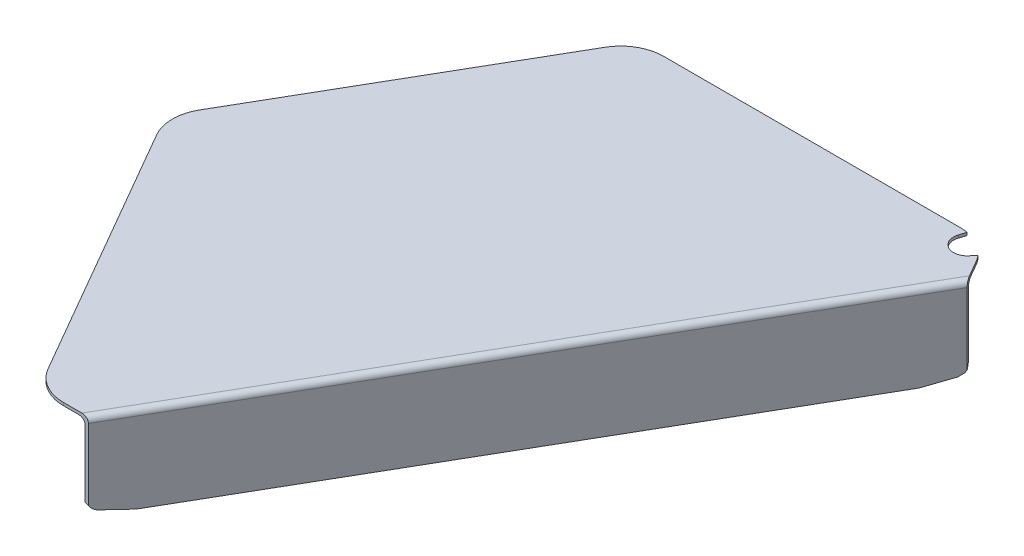
from build123d import *

# Parameters (mm, degrees)
SALIENTE_EXTRUIR1_DEPTH = 1
SALIENTE_EXTRUIR2_DEPTH = 31
REDONDEO1_R             = 2
CORTAR_EXTRUIR1_DEPTH   = 6


with BuildPart() as part:
    # Croquis1 → Saliente-Extruir1 (new body)
    with BuildSketch(Plane(origin=(0, 0, 0), x_dir=(1, 0, 0), z_dir=(0, 1, 0))):
        with BuildLine():
            Line((-115.079714212, -8.823380035), (-63.118189984, -98.823380035))
            ThreePointArc((-63.118189984, -98.823380035), (-57.627808928, -104.313761092), (-50.127808928, -106.323380035))
            Line((-50.127808928, -106.323380035), (-41.46755489, -106.323380035))
            Line((-41.46755489, -106.323380035), (71.115747602, 88.676619965))
            Line((71.115747602, 88.676619965), (66.785620583, 96.176619965))
            ThreePointArc((66.785620583, 96.176619965), (66.063002538, 97.308073533), (65.242113494, 98.370384784))
            Line((65.242113494, 98.370384784), (63.931741209, 96.784762544))
            ThreePointArc((63.931741209, 96.784762544), (57.937576979, 95.44880576), (55.609284572, 101.131572674))
            Line((55.609284572, 101.131572674), (56.358401529, 103.456004274))
            ThreePointArc((56.358401529, 103.456004274), (55.08155896, 103.621364269), (53.795239526, 103.676619965))
            Line((53.795239526, 103.676619965), (-50.127808928, 103.676619965))
            ThreePointArc((-50.127808928, 103.676619965), (-57.627808928, 101.667001022), (-63.118189984, 96.176619965))
            Line((-63.118189984, 96.176619965), (-115.079714212, 6.176619965))
            ThreePointArc((-115.079714212, 6.176619965), (-117.089333155, -1.323380035), (-115.079714212, -8.823380035))
        make_face()
    extrude(amount=SALIENTE_EXTRUIR1_DEPTH)

    # Croquis2 → Saliente-Extruir2 (add)
    with BuildSketch(Plane.XZ):
        Polygon((70.538397333, -89.676619965), (71.115747602, -88.676619965), (-41.46755489, 106.323380035), (-42.622255428, 106.323380035), align=None)
    extrude(amount=SALIENTE_EXTRUIR2_DEPTH)

    # Redondeo1
    redondeo1_edges = [part.edges().sort_by_distance(p)[0] for p in [
        (14.824096356, 1, 8.823380035),
        (13.958070952, 0, 8.323380035),
    ]]
    fillet(redondeo1_edges, radius=REDONDEO1_R)

    # Croquis3 → Cortar-Extruir1 (cut)
    with BuildSketch(Plane(origin=(14.938707896, 0, 8.624867025), x_dir=(0.49999999999999983, 0, -0.8660254037844387), z_dir=(0.8660254037844387, 0, 0.49999999999999983))):
        Polygon((-113.563080921, -25.247675121), (-125.074326682, -30.347704479), (-113.226187721, -43.828381759), (121.292947467, -43.828381759), (140.229409901, -2.708549898), (112.931429682, -24.627935946), (112.54714704, -25.775130018), (111.820569643, -26.693804208), (110.863696488, -27.186815933), (110.050651258, -27.653954581), (100.056518679, -29.2), (-100.514964838, -29.2), (-110.710724911, -27.588776313), (-111.83138376, -27.023487763), (-112.959989099, -25.847685272), align=None)
    extrude(amount=-CORTAR_EXTRUIR1_DEPTH, mode=Mode.SUBTRACT)


solid = part.part
